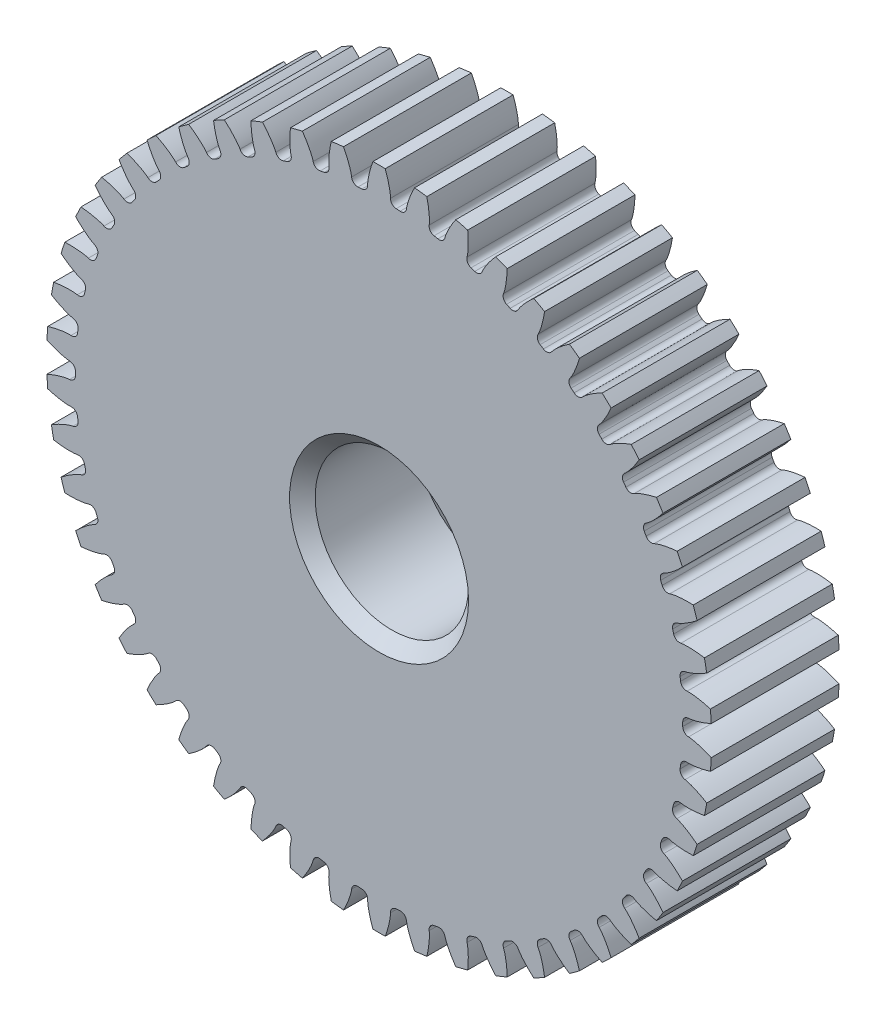
from build123d import *

# Parameters (mm, degrees)
SKETCH1_R              = 16.51
BODYBLANK_DEPTH        = 6.35
TOOTHCUTMASTER_DEPTH   = 25.196749782
TOOTHCUTSPATTERN_COUNT = 50
SKETCH2_R              = 3.81
CUT_EXTRUDE1_DEPTH     = 25.185687182
CHAMFER1_SIZE          = 0.635


with BuildPart() as part:
    # Sketch1 → BodyBlank (new body)
    with BuildSketch(Plane.XY):
        Circle(SKETCH1_R)
    extrude(amount=BODYBLANK_DEPTH)

    # EqDrivenInvoluteCurves → ToothCutMaster (cut, through all)
    with BuildSketch(Plane.XY.offset(6.35)):
        with BuildLine():
            Line((15.370880036, 0.397750068), (15.364200627, 0.397577226))
            add(Edge.make_bspline(
                [(15.364200627, 0.397577226), (15.365948834, 0.397636987), (15.370851207, 0.39784957), (15.380116156, 0.398429088), (15.395232068, 0.399627217), (15.414490314, 0.401525296), (15.439382471, 0.404405665), (15.468708443, 0.408348749), (15.500942587, 0.413259104), (15.536020747, 0.419225212), (15.571025799, 0.425729731), (15.605955506, 0.432733505), (15.64076115, 0.440175539), (15.682935518, 0.44974117), (15.733526211, 0.461977592), (15.792692156, 0.477400108), (15.859837609, 0.496215574), (15.92832441, 0.516813423), (15.995761918, 0.538251381), (16.063960365, 0.561262795), (16.129990407, 0.584484995), (16.198650654, 0.609998072), (16.262064095, 0.634254911), (16.333204119, 0.66298042), (16.39064078, 0.686613405), (16.450058455, 0.7123239), (16.478990566, 0.725029177), (16.493782362, 0.7316033)],
                knots=[0, 0, 0, 0, 0, 0.005376749, 0.015083688, 0.02853182, 0.04661014, 0.06485485, 0.092110526, 0.119476176, 0.146842496, 0.174208854, 0.201574956, 0.228941013, 0.256307345, 0.307035032, 0.361767352, 0.416499661, 0.471231937, 0.525964282, 0.580696616, 0.635428982, 0.690161387, 0.744893688, 0.799626082, 0.854358407, 0.909090914, 0.909090914, 0.909090914, 0.909090914, 0.909090914], degree=4))
            ThreePointArc((16.493782362, 0.7316033), (16.51, 0), (16.493782362, -0.7316033))
            add(Edge.make_bspline(
                [(15.364200627, -0.397577226), (15.365948834, -0.397636987), (15.370851207, -0.39784957), (15.380116156, -0.398429088), (15.395232068, -0.399627217), (15.414490314, -0.401525296), (15.439382471, -0.404405665), (15.468708443, -0.408348749), (15.500942587, -0.413259104), (15.536020747, -0.419225212), (15.571025799, -0.425729731), (15.605955506, -0.432733505), (15.64076115, -0.440175539), (15.682935518, -0.44974117), (15.733526211, -0.461977592), (15.792692156, -0.477400108), (15.859837609, -0.496215574), (15.92832441, -0.516813423), (15.995761918, -0.538251381), (16.063960365, -0.561262795), (16.129990407, -0.584484995), (16.198650654, -0.609998072), (16.262064095, -0.634254911), (16.333204119, -0.66298042), (16.39064078, -0.686613405), (16.450058455, -0.7123239), (16.478990566, -0.725029177), (16.493782362, -0.7316033)],
                knots=[0, 0, 0, 0, 0, 0.005376749, 0.015083688, 0.02853182, 0.04661014, 0.06485485, 0.092110526, 0.119476176, 0.146842496, 0.174208854, 0.201574956, 0.228941013, 0.256307345, 0.307035032, 0.361767352, 0.416499661, 0.471231937, 0.525964282, 0.580696616, 0.635428982, 0.690161387, 0.744893688, 0.799626082, 0.854358407, 0.909090914, 0.909090914, 0.909090914, 0.909090914, 0.909090914], degree=4))
            Line((15.364200627, -0.397577226), (15.370880036, -0.397750068))
            ThreePointArc((15.370880036, -0.397750068), (15.164724627, -0.307232502), (15.080929934, -0.098254197))
            ThreePointArc((15.080929934, -0.098254197), (15.08125, 0), (15.080929934, 0.098254197))
            ThreePointArc((15.080929934, 0.098254197), (15.164724627, 0.307232502), (15.370880036, 0.397750068))
        make_face()
    toothcutmaster = extrude(amount=-TOOTHCUTMASTER_DEPTH, mode=Mode.SUBTRACT)

    # ToothCutsPattern: ToothCutMaster ×50 about axis
    toothcutspattern_axis = Axis((0, 0, 6.35), (0, 0, -1))
    for i in range(1, TOOTHCUTSPATTERN_COUNT):
        add(toothcutmaster.rotate(toothcutspattern_axis, i * 360 / TOOTHCUTSPATTERN_COUNT), mode=Mode.SUBTRACT)

    # Sketch2 → Cut-Extrude1 (cut, through all)
    with BuildSketch(Plane.XY.offset(6.35)):
        Circle(SKETCH2_R)
    extrude(amount=-CUT_EXTRUDE1_DEPTH, mode=Mode.SUBTRACT)

    # Chamfer1
    chamfer1_edges = [part.edges().sort_by_distance(p)[0] for p in [
        (-3.81, 0, 0),
        (-3.81, 0, 6.35),
    ]]
    chamfer(chamfer1_edges, length=CHAMFER1_SIZE)


solid = part.part
